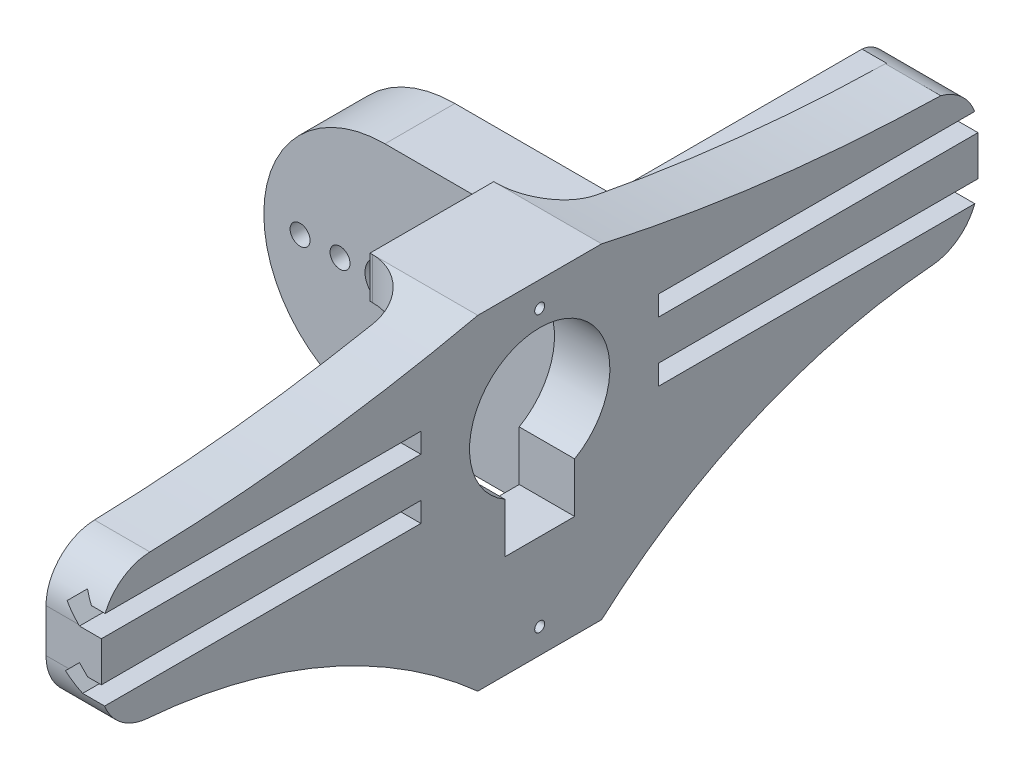
from build123d import *

# Parameters (mm, degrees)
SKETCH1_R               = 2
BOSS_EXTRUDE3_DEPTH     = 7
SKETCH3_R               = 1.0000000000000002
SKETCH3_R_2             = 0.9999999999999998
SKETCH3_R_3             = 0.9999999999999996
SKETCH3_R_4             = 0.9999999999999993
CUT_EXTRUDE2_DEPTH      = 26.09227496303999
BOSS_EXTRUDE4_START     = -7
BOSS_EXTRUDE4_DEPTH     = 7
BOSS_EXTRUDE5_START     = -30
BOSS_EXTRUDE5_DEPTH     = 30
FILLET2_R               = 1.5
CUT_EXTRUDE5_DEPTH      = 42.36510924463761
BOSS_EXTRUDE6_DEPTH     = 10.5
MOVE_START              = -28.7
MOVE_FACE1_DEPTH        = 5.7
DELETEFACE1_START       = 23.7
DELETEFACE1_OUTLINE_W   = 10.499999999999998
DELETEFACE1_OUTLINE_H   = 35.699999999999996
DELETEFACE1_DEPTH       = 15.7
SKETCH11_OUTSIDE_W      = 51.876
SKETCH11_OUTSIDE_H      = 42.462
CUT_EXTRUDE6_DEPTH      = 46.16926949380307
SERVO_START             = -12.760864102
SERVO_MICRO_OUTLINE_W   = 22.6
SERVO_MICRO_OUTLINE_H   = 12.399999999999999
SERVO_MICRO_DEPTH       = 22.3
SERVO_START_2           = 9.539135898
SERVO_MICRO_2_DEPTH     = 4.3
SERVO_START_3           = 2.889135898
SERVO_MICRO_3_DEPTH     = 2.4
SERVO_START_4           = 13.839135898
SERVO_MICRO_4_OUTLINE_R = 2.5
SERVO_MICRO_4_DEPTH     = 3.3
SERVO_START_5           = -25.667487826
SERVO_MICRO_5_OUTLINE_R = 0.6
SERVO_MICRO_5_DEPTH     = 2.3
SERVO_MICRO_6_OUTLINE_R = 0.6
SERVO_MICRO_6_DEPTH     = 2.3
SERVO_MICRO_7_OUTLINE_R = 0.6
SERVO_MICRO_7_DEPTH     = 2.3
BODY_MOVE_COPY1_ANGLE   = 90
SKETCH13_R              = 0.5000000000000009
SKETCH13_W              = 12.399999999999997
SKETCH13_H              = 4.17
SKETCH13_H_2            = 4.160545319150279
BOSS_EXTRUDE7_DEPTH     = 5.55
SKETCH13_3_W            = 12.399999999999997
SKETCH13_3_H            = 4.17
SKETCH13_3_R            = 0.5000000000000009
SKETCH13_3_H_2          = 4.160545319150279
BOSS_EXTRUDE8_DEPTH     = 10.8
CUT_EXTRUDE7_DEPTH      = 32
BOSS_EXTRUDE9_DEPTH     = 5.55
CUT_EXTRUDE8_DEPTH      = 72.0125468998838
BOSS_EXTRUDE10_DEPTH    = 5.55
FILLET4_R               = 5
CUT_EXTRUDE10_DEPTH     = 72.01254695034633
FILLET8_START           = 12.13472734
FILLET8_DEPTH           = 2.98662
FILLET8_START_2         = -12.463268044
FILLET8_2_DEPTH         = 0.328540704
FILLET8_START_3         = -16.295273118
FILLET8_3_DEPTH         = 3.832005074
FILLET8_START_4         = 15.12134734
FILLET8_4_DEPTH         = 1.18338
FILLET8_START_5         = -7.24411042
FILLET8_5_DEPTH         = 25.39411042
FILLET9_R               = 1


with BuildPart() as part:
    # Sketch1 → Boss-Extrude3 (new body)
    with BuildSketch(Plane.XY):
        with BuildLine():
            Line((5.606455718863049, 13.824363162033857), (-15.462379801128069, 15.791841653866829))
            Line((-15.462379801128069, 15.791841653866829), (-15.46237980112806, -15.791841653866806))
            Line((-15.46237980112806, -15.791841653866806), (5.606455718863063, -13.824363162033817))
            ThreePointArc((5.606455718863063, -13.824363162033817), (18.200000000000003, 2.613e-14), (5.606455718863049, 13.824363162033857))
        make_face()
        Circle(SKETCH1_R, mode=Mode.SUBTRACT)
    extrude(amount=BOSS_EXTRUDE3_DEPTH)

    # Sketch3 → Cut-Extrude2 (cut, through all)
    with BuildSketch(Plane.XY.offset(7)):
        with Locations((-4.5, 0)):
            Circle(SKETCH3_R)
        with Locations((-8.499999999999998, 0)):
            Circle(SKETCH3_R_2)
        with Locations(Location((4.5, -1.73e-15, 0), (0, 0, 180))):
            Circle(SKETCH3_R_3)
        with Locations(Location((8.499999999999998, -1.73e-15, 0), (0, 0, 180))):
            Circle(SKETCH3_R_4)
    extrude(amount=-CUT_EXTRUDE2_DEPTH, mode=Mode.SUBTRACT)

    # Sketch6 → Boss-Extrude4 (add)
    with BuildSketch(Plane.XY.offset(7).offset(BOSS_EXTRUDE4_START)):
        with BuildLine():
            Line((12.20372638619735, 13.208287910486863), (5.606455718863047, 13.824363162033858))
            ThreePointArc((5.606455718863047, 13.82436316203386), (18.2, 2.598e-14), (5.606455718863056, -13.824363162033816))
            Line((5.606455718863056, -13.824363162033816), (12.203726386197348, -13.208287910486817))
            ThreePointArc((12.203726386197348, -13.208287910486817), (19.699999999999996, 2.132e-14), (12.20372638619735, 13.20828791048686))
        make_face()
    extrude(amount=BOSS_EXTRUDE4_DEPTH)

    # Sketch6<3> → Boss-Extrude5 (add)
    with BuildSketch(Plane.XY.offset(7).offset(BOSS_EXTRUDE5_START)):
        with BuildLine():
            Line((23.700000000000006, 12.13472734042489), (12.20372638619735, 13.208287910486863))
            ThreePointArc((12.20372638619735, 13.20828791048686), (19.699999999999996, 2.132e-14), (12.203726386197348, -13.208287910486817))
            Line((12.203726386197348, -13.208287910486817), (23.700000000000003, -12.134727340424835))
            Line((23.700000000000003, -12.134727340424835), (23.700000000000006, 12.134727340424892))
        make_face()
    extrude(amount=BOSS_EXTRUDE5_DEPTH)

    # Fillet2
    fillet2_edges = [part.edges().sort_by_distance(p)[0] for p in [
        (12.20372638619735, -13.208287910486817, -11.5),
        (12.20372638619735, 13.208287910486861, -11.5),
    ]]
    fillet(fillet2_edges, radius=FILLET2_R)

    # Sketch8 → Cut-Extrude5 (cut, through all)
    with BuildSketch(Plane.XY.offset(7)):
        with BuildLine():
            Line((-15.462379801128069, 15.791841653866829), (-15.46237980112806, -15.791841653866808))
            Line((-15.46237980112806, -15.791841653866806), (1.328273056892355, -14.223874201150027))
            ThreePointArc((1.3282730568923518, -14.22387420115002), (-14.285758873920813, 0), (1.3282730568923529, 14.22387420115002))
            Line((1.3282730568923604, 14.223874201150062), (-15.462379801128069, 15.791841653866829))
        make_face()
    extrude(amount=-CUT_EXTRUDE5_DEPTH, mode=Mode.SUBTRACT)

    # Sketch10 → Boss-Extrude6 (add)
    with BuildSketch(Plane.ZX.offset(1.6347273404248903)):
        Polygon((7, 23.700000000000003), (7, 39.40000000018666), (-28.700000000000003, 39.40000000018665), (-28.700000000000014, 23.700000000000003), align=None)
    extrude(amount=BOSS_EXTRUDE6_DEPTH)

    # Move Face1: read off the stored shape, not the designer's step
    # Move Face1 outline → Move Face1 (add)
    with BuildSketch(Plane.XY.offset(MOVE_START)):
        with BuildLine():
            Line((17.033263706, -12.757289525), (23.7, -12.13472734))
            Line((23.7, -12.13472734), (23.7, 12.13472734))
            Line((23.7, 12.13472734), (17.033263706, 12.757289525))
            ThreePointArc((17.033263706, 12.757289525), (15.554272674, 11.938827155), (15.776353621, 10.263125757))
            ThreePointArc((15.776353621, 10.263125757), (19.7, 0), (15.776353621, -10.263125757))
            ThreePointArc((15.776353621, -10.263125757), (15.554272674, -11.938827155), (17.033263706, -12.757289525))
        make_face()
    extrude(amount=MOVE_FACE1_DEPTH)

    # DeleteFace1: read off the stored shape, not the designer's step
    # DeleteFace1 outline → DeleteFace1 (cut)
    with BuildSketch(Plane.YZ.offset(DELETEFACE1_START)):
        with Locations((6.884727339999999, -10.849999999999998)):
            Rectangle(DELETEFACE1_OUTLINE_W, DELETEFACE1_OUTLINE_H)
    extrude(amount=DELETEFACE1_DEPTH, mode=Mode.SUBTRACT)

    # Sketch11 outside → Cut-Extrude6 (cut, through all)
    with BuildSketch(Plane.XY.offset(7)):
        with Locations((4.706999999999997, 0)):
            Rectangle(SKETCH11_OUTSIDE_W, SKETCH11_OUTSIDE_H)
        with BuildLine():
            Line((23.700000000000003, 12.134727340424888), (-1.43e-15, 12.134727340424885))
            ThreePointArc((-1.43e-15, 12.134727340424885), (-12.134727340424885, 1.49e-15), (0, -12.134727340424885))
            Line((0, -12.134727340424885), (23.700000000000006, -12.134727340424835))
            Line((23.700000000000006, -12.134727340424835), (23.700000000000003, 12.134727340424888))
        make_face(mode=Mode.SUBTRACT)
    extrude(amount=-CUT_EXTRUDE6_DEPTH, mode=Mode.SUBTRACT)

    # Sketch13 → Boss-Extrude7 (add)
    # profile 1 of 3: a face of its own
    with BuildSketch(Plane(origin=(23.700000000000003, -3.39e-15, 0), x_dir=(0, 0, -1), z_dir=(1, -1.4e-16, 0))):
        Polygon((-9.000000000000002, -16.295272659575108), (-9.000000000000002, -12.134727340424831), (-7, -12.134727340424831), (-6.999999999999999, 12.134727340424892), (-9.000000000000002, 12.13472734042489), (-9.000000000000002, 16.30472734042489), (-21.4, 16.30472734042489), (-21.4, 12.13472734042489), (-59.100000000000016, 12.134727340424885), (-59.100000000000016, -12.134727340424831), (-21.4, -12.134727340424831), (-21.4, -16.295272659575108), align=None)
        with Locations(Location((-15.200000000000001, 13.80472734042489, 0), (0, 0, 90))):
            Circle(SKETCH13_R, mode=Mode.SUBTRACT)
        with Locations(Location((-15.200000000000001, -13.79527265957511, 0), (0, 0, 90))):
            Circle(SKETCH13_R, mode=Mode.SUBTRACT)
        with BuildLine():
            ThreePointArc((-11.700000000000001, -0.9920668991734916), (-15.199999999999998, 12.13472734042489), (-18.700000000000003, -0.9920668991734924))
            Line((-18.700000000000003, -0.9920668991734924), (-18.700000000000003, -5.9920668991734924))
            Line((-18.700000000000003, -5.9920668991734924), (-11.700000000000003, -5.992066899173492))
            Line((-11.700000000000003, -5.992066899173492), (-11.700000000000001, -0.9920668991734916))
        make_face(mode=Mode.SUBTRACT)
    # profile 2 of 3: a face of its own
    with BuildSketch(Plane(origin=(23.700000000000003, -3.39e-15, 0), x_dir=(0, 0, -1), z_dir=(1, -1.4e-16, 0))):
        with Locations((-15.2, 14.219727340424889)):
            Rectangle(SKETCH13_W, SKETCH13_H)
        with Locations(Location((-15.200000000000001, 13.80472734042489, 0), (0, 0, 90))):
            Circle(SKETCH13_R, mode=Mode.SUBTRACT)
    # profile 3 of 3: a face of its own
    with BuildSketch(Plane(origin=(23.700000000000003, -3.39e-15, 0), x_dir=(0, 0, -1), z_dir=(1, -1.4e-16, 0))):
        with Locations((-15.2, -14.214999999999968)):
            Rectangle(SKETCH13_W, SKETCH13_H_2)
        with Locations(Location((-15.200000000000001, -13.79527265957511, 0), (0, 0, 90))):
            Circle(SKETCH13_R, mode=Mode.SUBTRACT)
    extrude(amount=-BOSS_EXTRUDE7_DEPTH)

    # Sketch13<3> → Boss-Extrude8 (add)
    # profile 1 of 2: a face of its own
    with BuildSketch(Plane(origin=(23.700000000000003, -3.39e-15, 0), x_dir=(0, 0, -1), z_dir=(1, -1.4e-16, 0))):
        with Locations((-15.2, 14.219727340424889)):
            Rectangle(SKETCH13_3_W, SKETCH13_3_H)
        with Locations(Location((-15.200000000000001, 13.80472734042489, 0), (0, 0, 90))):
            Circle(SKETCH13_3_R, mode=Mode.SUBTRACT)
    # profile 2 of 2: a face of its own
    with BuildSketch(Plane(origin=(23.700000000000003, -3.39e-15, 0), x_dir=(0, 0, -1), z_dir=(1, -1.4e-16, 0))):
        with Locations((-15.2, -14.214999999999968)):
            Rectangle(SKETCH13_3_W, SKETCH13_3_H_2)
        with Locations(Location((-15.200000000000001, -13.79527265957511, 0), (0, 0, 90))):
            Circle(SKETCH13_3_R, mode=Mode.SUBTRACT)
    extrude(amount=-BOSS_EXTRUDE8_DEPTH)

    # Sketch15 → Cut-Extrude7 (cut)
    with BuildSketch(Plane(origin=(1.903e-14, 0, -28.70000000000003), x_dir=(-1, 0, -6.6e-16), z_dir=(6.6e-16, 0, -1))):
        Polygon((-22.328427124746177, 3.104727340424887), (-23.699999999999985, 3.104727340424887), (-23.699999999999985, 1.1047273404248876), (-21.499999999999986, 1.1047273404248876), (-20.08578643762689, 2.5189409027979854), (-21.49999999999999, 3.9331544651710773), align=None)
        Polygon((-22.328427124746177, 9.104727340424887), (-23.699999999999985, 9.104727340424887), (-23.699999999999985, 7.104727340424887), (-21.499999999999986, 7.104727340424887), (-20.08578643762689, 8.518940902797986), (-21.49999999999999, 9.933154465171077), align=None)
    cut_extrude7 = extrude(amount=-CUT_EXTRUDE7_DEPTH, mode=Mode.SUBTRACT)

    # Mirror1: Cut-Extrude7 across plane
    add(cut_extrude7.mirror(Plane(origin=(0, 0, 15.200000000000001), x_dir=(1, 0, 0), z_dir=(0, 0, -1))), mode=Mode.SUBTRACT)

    # Sketch16 → Boss-Extrude9 (add)
    with BuildSketch(Plane(origin=(23.700000000000003, -3.39e-15, 0), x_dir=(0, 0, -1), z_dir=(1, -1.4e-16, 0))):
        with BuildLine():
            Line((-21.4, 12.13472734042489), (-21.4, 16.30472734042489))
            ThreePointArc((-21.4, 16.30472734042489), (-40.135039546574305, 13.18039662240372), (-59.100000000000016, 12.134727340424885))
            Line((-59.100000000000016, 12.134727340424885), (-21.4, 12.13472734042489))
        make_face()
        with BuildLine():
            Line((-9.000000000000002, 16.30472734042489), (-9.000000000000002, 12.13472734042489))
            Line((-9.000000000000002, 12.13472734042489), (28.700000000000014, 12.134727340424892))
            ThreePointArc((28.700000000000014, 12.134727340424892), (9.735039546574328, 13.180396622403777), (-9.000000000000002, 16.30472734042489))
        make_face()
    extrude(amount=-BOSS_EXTRUDE9_DEPTH)

    # Sketch18 → Cut-Extrude8 (cut, through all)
    with BuildSketch(Plane(origin=(23.700000000000003, -3.39e-15, 0), x_dir=(0, 0, -1), z_dir=(1, -1.4e-16, 0))):
        with BuildLine():
            Line((-59.100000000000016, -12.134727340424831), (-26.661429094135563, -12.134727340424831))
            ThreePointArc((-26.661429094135563, -12.134727340424838), (-42.096369157624615, -4.537893974213425), (-59.100000000000016, -1.9252726595751))
            Line((-59.100000000000016, -1.9252726595751037), (-59.100000000000016, -12.134727340424831))
        make_face()
        with BuildLine():
            Line((-3.7385709058644423, -12.134727340424831), (28.700000000000003, -12.134727340424831))
            Line((28.700000000000003, -12.134727340424831), (28.700000000000003, -1.9252726595751037))
            ThreePointArc((28.700000000000003, -1.9252726595751), (11.69636915762461, -4.537893974213425), (-3.738570905864435, -12.134727340424838))
        make_face()
    extrude(amount=-CUT_EXTRUDE8_DEPTH, mode=Mode.SUBTRACT)

    # Sketch18<3> → Boss-Extrude10 (add)
    with BuildSketch(Plane(origin=(23.700000000000003, -3.39e-15, 0), x_dir=(0, 0, -1), z_dir=(1, -1.4e-16, 0))):
        with BuildLine():
            ThreePointArc((-26.661429094135563, -12.134727340424838), (-23.96906894889605, -14.137042924937433), (-21.4, -16.295272659575097))
            Line((-21.4, -16.295272659575108), (-21.4, -12.134727340424831))
            Line((-21.4, -12.134727340424831), (-26.66142909413556, -12.134727340424831))
        make_face()
        with BuildLine():
            ThreePointArc((-9, -16.295272659575097), (-6.430931051103947, -14.137042924937433), (-3.738570905864435, -12.134727340424838))
            Line((-3.7385709058644423, -12.134727340424831), (-9.000000000000005, -12.134727340424831))
            Line((-9.000000000000005, -12.134727340424831), (-9.000000000000005, -16.295272659575108))
        make_face()
    extrude(amount=-BOSS_EXTRUDE10_DEPTH)

    # Fillet4
    fillet4_edges = [part.edges().sort_by_distance(p)[0] for p in [
        (21.63952842596371, -1.9252726595751048, -28.700000000000003),
        (20.925, -1.925272659575101, 59.10000000000002),
        (20.925000000000004, 12.134727340424881, 59.100000000000016),
    ]]
    fillet(fillet4_edges, radius=FILLET4_R)

    # Sketch19 → Cut-Extrude10 (cut, through all)
    with BuildSketch(Plane(origin=(23.700000000000003, -3.39e-15, 0), x_dir=(0, 0, -1), z_dir=(1, -1.4e-16, 0))):
        with BuildLine():
            Line((24.105591483628846, 12.321380196120076), (30.19974331893468, 12.321380196120076))
            Line((30.19974331893468, 12.321380196120076), (30.19974331893468, 7.512752922909521))
            Line((30.19974331893468, 7.512752922909521), (28.687547870024137, 7.690513778051795))
            ThreePointArc((28.687547870024137, 7.690513778051795), (28.58393863914358, 8.408905582685197), (28.37741082226619, 9.10472734042489))
            ThreePointArc((28.37741082226619, 9.10472734042489), (26.70764725474025, 11.33211091295099), (24.105591483628846, 12.321380196120076))
        make_face()
    extrude(amount=-CUT_EXTRUDE10_DEPTH, mode=Mode.SUBTRACT)

    # Fillet8: read off the stored shape, not the designer's step
    # Fillet8 outline → Fillet8 (add)
    with BuildSketch(Plane(origin=(0, 0, 0), x_dir=(1, 0, 0), z_dir=(0, 1, 0)).offset(FILLET8_START)):
        with BuildLine():
            Line((13.15, -9), (18.15, -9))
            Line((18.15, -9), (18.15, -4))
            ThreePointArc((18.15, -4), (16.685533906, -7.535533906), (13.15, -9))
        make_face()
        with BuildLine():
            ThreePointArc((13.15, -21.4), (16.685533906, -22.864466094), (18.15, -26.4))
            Line((18.15, -26.4), (18.15, -21.4))
            Line((18.15, -21.4), (13.15, -21.4))
        make_face()
    extrude(amount=FILLET8_DEPTH)

    # Fillet8 2 outline → Fillet8 2 (add)
    with BuildSketch(Plane(origin=(0, 0, 0), x_dir=(1, 0, 0), z_dir=(0, 1, 0)).offset(FILLET8_START_2)):
        with BuildLine():
            Line((13.15, -9), (18.15, -9))
            Line((18.15, -9), (18.15, -4))
            ThreePointArc((18.15, -4), (16.685533906, -7.535533906), (13.15, -9))
        make_face()
        with BuildLine():
            ThreePointArc((13.15, -21.4), (16.685533906, -22.864466094), (18.15, -26.4))
            Line((18.15, -26.4), (18.15, -21.4))
            Line((18.15, -21.4), (13.15, -21.4))
        make_face()
    extrude(amount=FILLET8_2_DEPTH)

    # Fillet8 3 outline → Fillet8 3 (add)
    with BuildSketch(Plane(origin=(0, 0, 0), x_dir=(1, 0, 0), z_dir=(0, 1, 0)).offset(FILLET8_START_3)):
        with BuildLine():
            ThreePointArc((13.15, -21.4), (16.685533906, -22.864466094), (18.15, -26.4))
            Line((18.15, -26.4), (18.15, -21.4))
            Line((18.15, -21.4), (13.15, -21.4))
        make_face()
        with BuildLine():
            ThreePointArc((18.15, -4), (16.685533906, -7.535533906), (13.15, -9))
            Line((13.15, -9), (18.15, -9))
            Line((18.15, -9), (18.15, -4))
        make_face()
    extrude(amount=FILLET8_3_DEPTH)

    # Fillet8 4 outline → Fillet8 4 (add)
    with BuildSketch(Plane(origin=(0, 0, 0), x_dir=(1, 0, 0), z_dir=(0, 1, 0)).offset(FILLET8_START_4)):
        with BuildLine():
            ThreePointArc((13.15, -21.4), (16.685533906, -22.864466094), (18.15, -26.4))
            Line((18.15, -26.4), (18.15, -21.4))
            Line((18.15, -21.4), (13.15, -21.4))
        make_face()
        with BuildLine():
            ThreePointArc((18.15, -4), (16.685533906, -7.535533906), (13.15, -9))
            Line((13.15, -9), (18.15, -9))
            Line((18.15, -9), (18.15, -4))
        make_face()
    extrude(amount=FILLET8_4_DEPTH)

    # Fillet8 5 outline → Fillet8 5 (cut)
    with BuildSketch(Plane.YZ.offset(FILLET8_START_5)):
        with BuildLine():
            ThreePointArc((-12.31848008, 4), (-14.236321993, 6.556116122), (-16.295272761, 9.000000114))
            Line((-16.295272761, 9.000000114), (-16.295273118, 4))
            Line((-16.295273118, 4), (-12.31848008, 4))
        make_face()
        with BuildLine():
            Line((-16.295273118, 26.4), (-16.295272761, 21.399999886))
            ThreePointArc((-16.295272761, 21.399999886), (-14.236321993, 23.843883878), (-12.31848008, 26.4))
            Line((-12.31848008, 26.4), (-16.295273118, 26.4))
        make_face()
        with BuildLine():
            Line((16.30472734, 26.4), (15.262410605, 26.4))
            ThreePointArc((15.262410605, 26.4), (15.765062943, 23.896142171), (16.30472734, 21.4))
            Line((16.30472734, 21.4), (16.30472734, 26.4))
        make_face()
        with BuildLine():
            Line((16.30472734, 4), (16.30472734, 9))
            ThreePointArc((16.30472734, 9), (15.765062943, 6.503857829), (15.262410605, 4))
            Line((15.262410605, 4), (16.30472734, 4))
        make_face()
    extrude(amount=FILLET8_5_DEPTH, mode=Mode.SUBTRACT)

    # Fillet9
    fillet9_edges = [part.edges().sort_by_distance(p)[0] for p in [
        (18.150000000000002, 2.76e-14, 7),
    ]]
    fillet(fillet9_edges, radius=FILLET9_R)


with BuildPart() as body_2:
    # Servo Micro: read off the stored shape, not the designer's step
    # Servo Micro outline → Servo Micro (new body)
    with BuildSketch(Plane(origin=(0, 0, 0), x_dir=(1, 0, 0), z_dir=(0, 1, 0)).offset(SERVO_START)):
        with Locations((-12.067487826, -26.388081974)):
            Rectangle(SERVO_MICRO_OUTLINE_W, SERVO_MICRO_OUTLINE_H)
    extrude(amount=SERVO_MICRO_DEPTH)

    # Servo Micro 2 outline → Servo Micro 2 (add)
    with BuildSketch(Plane(origin=(0, 0, 0), x_dir=(1, 0, 0), z_dir=(0, 1, 0)).offset(SERVO_START_2)):
        with BuildLine():
            ThreePointArc((-11.10082116, -25.109193568), (-23.367487826, -26.388081974), (-11.10082116, -27.666970381))
            ThreePointArc((-11.10082116, -27.666970381), (-9.567487826, -26.388081975), (-11.10082116, -25.109193568))
        make_face()
    extrude(amount=SERVO_MICRO_2_DEPTH)

    # Servo Micro 3 outline → Servo Micro 3 (add)
    with BuildSketch(Plane(origin=(0, 0, 0), x_dir=(1, 0, 0), z_dir=(0, 1, 0)).offset(SERVO_START_3)):
        with BuildLine():
            Line((2.567676828, -25.838081974), (4.232512174, -25.838081974))
            Line((4.232512174, -25.838081974), (4.232512174, -20.188081974))
            Line((4.232512174, -20.188081974), (-0.767487826, -20.188081974))
            Line((-0.767487826, -20.188081974), (-0.767487826, -32.588081974))
            Line((-0.767487826, -32.588081974), (4.232512174, -32.588081974))
            Line((4.232512174, -32.588081974), (4.232512174, -26.938081974))
            Line((4.232512174, -26.938081974), (2.567676828, -26.938081974))
            ThreePointArc((2.567676828, -26.938081974), (0.732512174, -26.388081974), (2.567676828, -25.838081974))
        make_face()
        with BuildLine():
            Line((-23.367487826, -32.588081974), (-23.367487826, -20.188081974))
            Line((-23.367487826, -20.188081974), (-28.367487826, -20.188081974))
            Line((-28.367487826, -20.188081974), (-28.367487826, -25.838081974))
            Line((-28.367487826, -25.838081974), (-26.702652481, -25.838081974))
            ThreePointArc((-26.702652481, -25.838081974), (-24.867487826, -26.388081974), (-26.702652481, -26.938081974))
            Line((-26.702652481, -26.938081974), (-28.367487826, -26.938081974))
            Line((-28.367487826, -26.938081974), (-28.367487826, -32.588081974))
            Line((-28.367487826, -32.588081974), (-23.367487826, -32.588081974))
        make_face()
    extrude(amount=SERVO_MICRO_3_DEPTH)

    # Servo Micro 4 outline → Servo Micro 4 (add)
    with BuildSketch(Plane(origin=(0, 0, 0), x_dir=(1, 0, 0), z_dir=(0, 1, 0)).offset(SERVO_START_4)):
        with Locations((-17.167487826, -26.388081974)):
            Circle(SERVO_MICRO_4_OUTLINE_R)
    extrude(amount=SERVO_MICRO_4_DEPTH)


with BuildPart() as body_3:
    # Servo Micro 5 outline → Servo Micro 5 (new body)
    with BuildSketch(Plane.YZ.offset(SERVO_START_5)):
        with Locations((-8.260864102, 25.188081974)):
            Circle(SERVO_MICRO_5_OUTLINE_R)
    extrude(amount=SERVO_MICRO_5_DEPTH)


with BuildPart() as body_4:
    # Servo Micro 6 outline → Servo Micro 6 (new body)
    with BuildSketch(Plane.YZ.offset(SERVO_START_5)):
        with Locations((-8.260864102, 27.588081974)):
            Circle(SERVO_MICRO_6_OUTLINE_R)
    extrude(amount=SERVO_MICRO_6_DEPTH)


with BuildPart() as body_5:
    # Servo Micro 7 outline → Servo Micro 7 (new body)
    with BuildSketch(Plane.YZ.offset(SERVO_START_5)):
        with Locations((-8.260864102, 26.388081974)):
            Circle(SERVO_MICRO_7_OUTLINE_R)
    extrude(amount=SERVO_MICRO_7_DEPTH)


with BuildPart() as body_2_1:
    # Body-Move/Copy1: read off the stored shape, not the designer's step
    # Body-Move/Copy1: moved
    add(body_2.part.moved(Location((12.0627605, 7.6108641, -11.188082))).rotate(Axis((0, 0, 0), (0, 0, -1)), BODY_MOVE_COPY1_ANGLE))


solid = part.part
